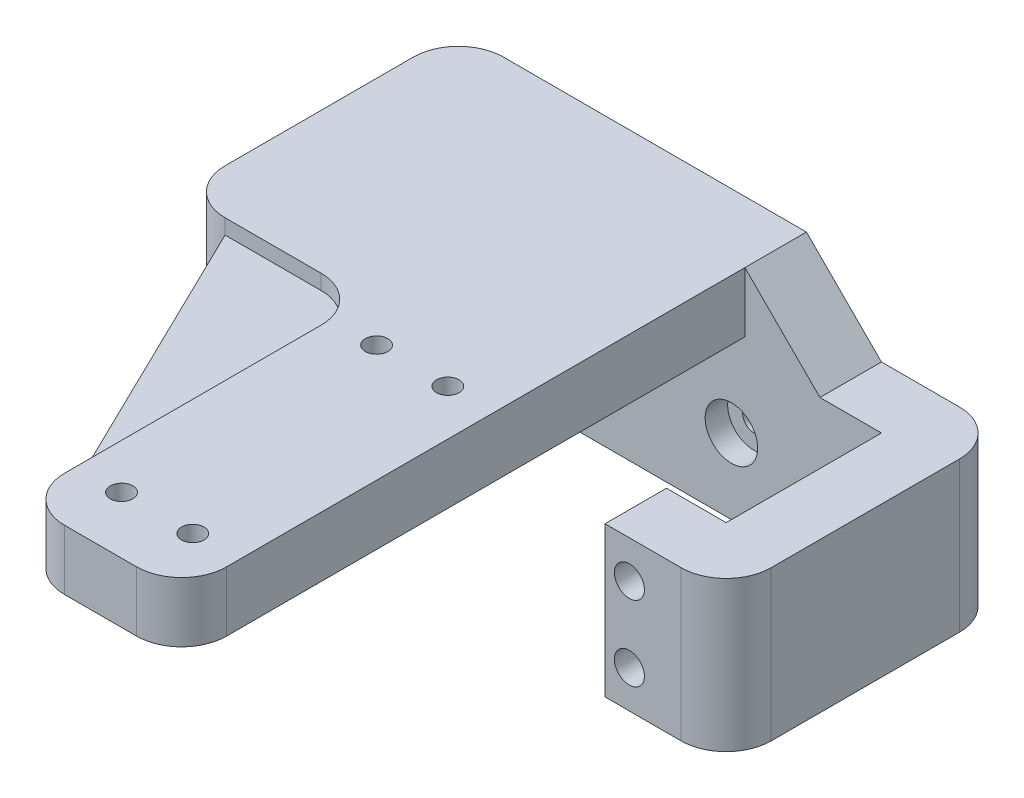
from build123d import *

# Parameters (mm, degrees)
SCHIZZO1_W                                   = 64.6
SCHIZZO1_H                                   = 20
ESTRUSIONE_ESTRUSIONE1_DEPTH                 = 8.2
SCHIZZO2_W                                   = 8.2
SCHIZZO2_H                                   = 20
ESTRUSIONE_ESTRUSIONE2_DEPTH                 = 28.9
SCHIZZO3_W                                   = 8.2
SCHIZZO3_H                                   = 20
ESTRUSIONE_ESTRUSIONE3_DEPTH                 = 28.9
SCHIZZO4_W                                   = 8.2
SCHIZZO4_H                                   = 20
ESTRUSIONE_ESTRUSIONE4_DEPTH                 = 8.2
SCHIZZO5_W                                   = 37.1
SCHIZZO5_H                                   = 20
ESTRUSIONE_ESTRUSIONE5_DEPTH                 = 8.2
SCHIZZO6_W                                   = 48.2
SCHIZZO6_H                                   = 20.7
TAGLIO_ESTRUSIONE1_DEPTH                     = 78.133455776
F_4_0_4_DIAMETER_HOLE2_D                     = 4
F_4_0_4_DIAMETER_HOLE2_DEPTH                 = 8.2
RACCORDO3_R                                  = 6
CBORE_FOR_M3_HEX_HEAD_CAP_SCREW1_D           = 3
CBORE_FOR_M3_HEX_HEAD_CAP_SCREW1_CBORE_D     = 7
CBORE_FOR_M3_HEX_HEAD_CAP_SCREW1_CBORE_DEPTH = 3
SKETCH5_W                                    = 46.4
SKETCH5_H                                    = 37.1
BOSS_EXTRUDE1_DEPTH                          = 10
FILLET3_R                                    = 6
CHAMFER2_SIZE                                = 10
CUT_EXTRUDE2_DEPTH                           = 2
SKETCH9_W                                    = 40.4
SKETCH9_H                                    = 8
BOSS_EXTRUDE2_DEPTH                          = 46.2
CBORE_FOR_M3_HEX_HEAD_CAP_SCREW2_D           = 3
CBORE_FOR_M3_HEX_HEAD_CAP_SCREW2_CBORE_D     = 7
CBORE_FOR_M3_HEX_HEAD_CAP_SCREW2_CBORE_DEPTH = 3
CUT_EXTRUDE3_DEPTH                           = 108.684957167
FILLET4_R                                    = 6
SKETCH15_W                                   = 8.2
SKETCH15_H                                   = 20
CUT_EXTRUDE4_DEPTH                           = 0.25
SKETCH16_W                                   = 8.2
SKETCH16_H                                   = 22
CUT_EXTRUDE5_DEPTH                           = 0.25
CUT_EXTRUDE6_DEPTH                           = 2
CUT_EXTRUDE7_DEPTH                           = 2
FILLET5_R                                    = 6
FILLET6_R                                    = 6


with BuildPart() as part:
    # Schizzo1 → Estrusione-Estrusione1 (new body)
    with BuildSketch(Plane.XY):
        with Locations((32.3, 10)):
            Rectangle(SCHIZZO1_W, SCHIZZO1_H)
    extrude(amount=ESTRUSIONE_ESTRUSIONE1_DEPTH)

    # Schizzo2 → Estrusione-Estrusione2 (add)
    with BuildSketch(Plane.XY.offset(8.2)):
        with Locations((4.1, 10)):
            Rectangle(SCHIZZO2_W, SCHIZZO2_H)
    extrude(amount=ESTRUSIONE_ESTRUSIONE2_DEPTH)

    # Schizzo3 → Estrusione-Estrusione3 (add)
    with BuildSketch(Plane.XY.offset(8.2)):
        with Locations((60.5, 10)):
            Rectangle(SCHIZZO3_W, SCHIZZO3_H)
    extrude(amount=ESTRUSIONE_ESTRUSIONE3_DEPTH)

    # Schizzo4 → Estrusione-Estrusione4 (add)
    with BuildSketch(Plane.ZY.offset(-56.4)):
        with Locations((33, 10)):
            Rectangle(SCHIZZO4_W, SCHIZZO4_H)
    extrude(amount=ESTRUSIONE_ESTRUSIONE4_DEPTH)

    # Schizzo5 → Estrusione-Estrusione5 (add)
    with BuildSketch(Plane.ZY):
        with Locations((18.55, 10)):
            Rectangle(SCHIZZO5_W, SCHIZZO5_H)
    extrude(amount=ESTRUSIONE_ESTRUSIONE5_DEPTH)

    # Schizzo6 → Taglio-Estrusione1 (cut, through all)
    with BuildSketch(Plane.XZ):
        with Locations((24.1, 18.55)):
            Rectangle(SCHIZZO6_W, SCHIZZO6_H)
    extrude(amount=-TAGLIO_ESTRUSIONE1_DEPTH, mode=Mode.SUBTRACT)

    # Ø4.0 (4) Diameter Hole2
    with Locations(Plane.XY.offset(37.1)):
        with Locations((51.7, 5), (4.7, 5), (4.7, 15), (51.7, 15)):
            Hole(F_4_0_4_DIAMETER_HOLE2_D / 2, depth=F_4_0_4_DIAMETER_HOLE2_DEPTH)

    # Raccordo3
    raccordo3_edges = [part.edges().sort_by_distance(p)[0] for p in [
        (64.6, 10, 37.1),
        (64.6, 10, 0),
    ]]
    fillet(raccordo3_edges, radius=RACCORDO3_R)

    # CBORE for M3 Hex Head Cap Screw1 (through all)
    with Locations(Plane.XY.offset(8.2)):
        with Locations((36.4, 10), (12.4, 10)):
            CounterBoreHole(CBORE_FOR_M3_HEX_HEAD_CAP_SCREW1_D / 2, CBORE_FOR_M3_HEX_HEAD_CAP_SCREW1_CBORE_D / 2, CBORE_FOR_M3_HEX_HEAD_CAP_SCREW1_CBORE_DEPTH)

    # Sketch5 → Boss-Extrude1 (add)
    with BuildSketch(Plane(origin=(0, 20, 0), x_dir=(1, 0, 0), z_dir=(0, 1, 0))):
        with Locations((15, -18.55)):
            Rectangle(SKETCH5_W, SKETCH5_H)
    extrude(amount=BOSS_EXTRUDE1_DEPTH)

    # Fillet3
    fillet3_edges = [part.edges().sort_by_distance(p)[0] for p in [
        (-8.2, 15, 37.1),
        (-8.2, 15, 0),
    ]]
    fillet(fillet3_edges, radius=FILLET3_R)

    # Chamfer2
    chamfer2_edges = [part.edges().sort_by_distance(p)[0] for p in [
        (38.2, 20, 4.1),
    ]]
    chamfer(chamfer2_edges, length=CHAMFER2_SIZE - 0.0001)  # a hair under: the kernel refuses the full size

    # Sketch8 → Cut-Extrude2 (cut)
    with BuildSketch(Plane(origin=(0, 20, 0), x_dir=(-1, 0, 0), z_dir=(0, -1, 0))):
        Polygon((-38.2, -37.1), (-38.2, -8.2), (0, -8.2), (0, -28.9), (-8.2, -28.9), (-8.2, -37.1), align=None)
    extrude(amount=-CUT_EXTRUDE2_DEPTH, mode=Mode.SUBTRACT)

    # Sketch9 → Boss-Extrude2 (add)
    with BuildSketch(Plane.XY.offset(37.1)):
        with Locations((18, 26)):
            Rectangle(SKETCH9_W, SKETCH9_H)
    extrude(amount=BOSS_EXTRUDE2_DEPTH)

    # CBORE for M3 Hex Head Cap Screw2 (through all)
    with Locations(Plane(origin=(0, 22, 0), x_dir=(-1, 0, 0), z_dir=(0, -1, 0))):
        with Locations((-22.6, -41.7), (-32.1, -41.7), (-22.6, -75.7), (-32.1, -75.7)):
            CounterBoreHole(CBORE_FOR_M3_HEX_HEAD_CAP_SCREW2_D / 2, CBORE_FOR_M3_HEX_HEAD_CAP_SCREW2_CBORE_D / 2, CBORE_FOR_M3_HEX_HEAD_CAP_SCREW2_CBORE_DEPTH)

    # Sketch13 → Cut-Extrude3 (cut, through all)
    with BuildSketch(Plane(origin=(0, 22, 0), x_dir=(-1, 0, 0), z_dir=(0, -1, 0))):
        Polygon((-16.6, -75.7), (-16.6, -83.3), (2.2, -83.3), (2.2, -37.1), align=None)
    extrude(amount=-CUT_EXTRUDE3_DEPTH, mode=Mode.SUBTRACT)

    # Fillet4
    fillet4_edges = [part.edges().sort_by_distance(p)[0] for p in [
        (38.2, 26, 83.3),
    ]]
    fillet(fillet4_edges, radius=FILLET4_R)

    # Sketch15 → Cut-Extrude4 (cut)
    with BuildSketch(Plane.ZY.offset(-48.2)):
        with Locations((33, 10)):
            Rectangle(SKETCH15_W, SKETCH15_H)
    extrude(amount=-CUT_EXTRUDE4_DEPTH, mode=Mode.SUBTRACT)

    # Sketch16 → Cut-Extrude5 (cut)
    with BuildSketch(Plane(origin=(8.2, 0, 0), x_dir=(0, 0, -1), z_dir=(1, 0, 0))):
        with Locations((-33, 11)):
            Rectangle(SKETCH16_W, SKETCH16_H)
    extrude(amount=-CUT_EXTRUDE5_DEPTH, mode=Mode.SUBTRACT)

    # Sketch21 → Cut-Extrude6 (cut)
    with BuildSketch(Plane(origin=(0, 30, 0), x_dir=(1, 0, 0), z_dir=(0, 1, 0))):
        Polygon((-2.2, -37.1), (16.6, -37.1), (16.6, -75.7), align=None)
    extrude(amount=-CUT_EXTRUDE6_DEPTH, mode=Mode.SUBTRACT)

    # Sketch22 → Cut-Extrude7 (cut)
    with BuildSketch(Plane(origin=(0, 22, 0), x_dir=(-1, 0, 0), z_dir=(0, -1, 0))):
        Polygon((2.2, -37.1), (-16.6, -37.1), (-16.6, -75.7), align=None)
    extrude(amount=-CUT_EXTRUDE7_DEPTH, mode=Mode.SUBTRACT)

    # Fillet5
    fillet5_edges = [part.edges().sort_by_distance(p)[0] for p in [
        (16.6, 26, 83.3),
    ]]
    fillet(fillet5_edges, radius=FILLET5_R)

    # Fillet6
    fillet6_edges = [part.edges().sort_by_distance(p)[0] for p in [
        (16.6, 29, 37.1),
        (16.6, 23, 37.1),
    ]]
    fillet(fillet6_edges, radius=FILLET6_R)


solid = part.part
